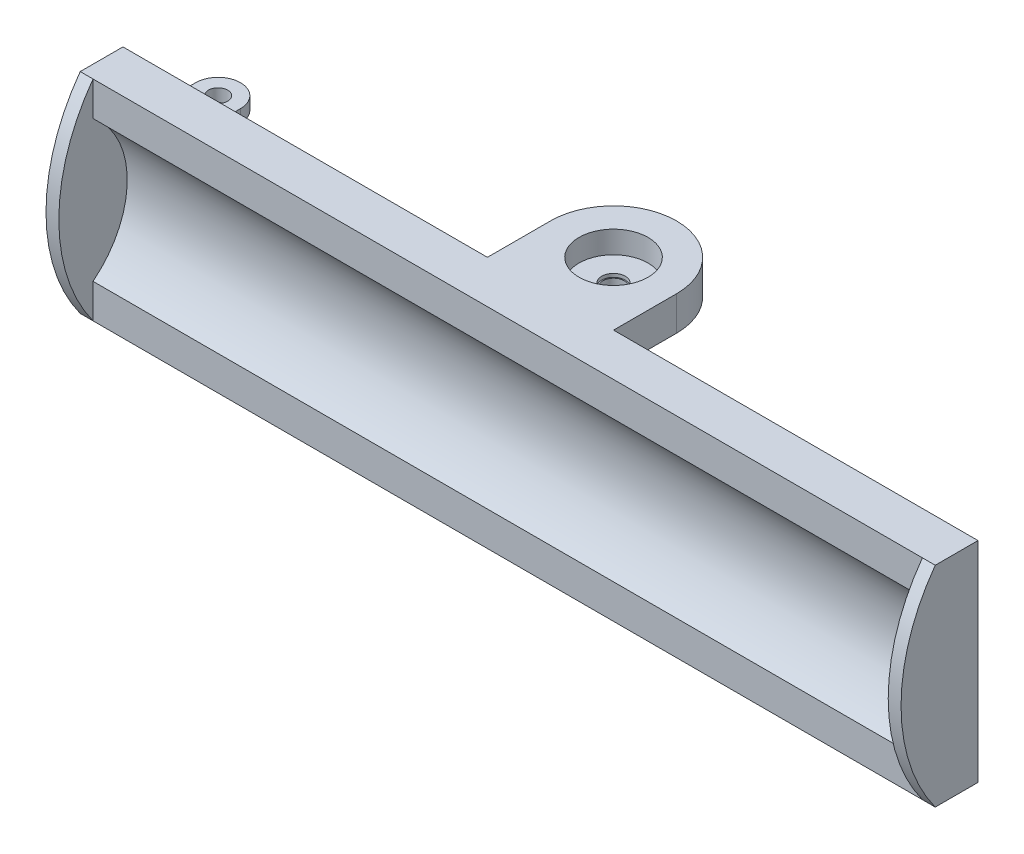
from build123d import *

# Parameters (mm, degrees)
BOSS_EXTRUDE1_DEPTH = 100
SKETCH3_R           = 2.75
BOSS_EXTRUDE2_DEPTH = 8
SKETCH4_R           = 8.075
SKETCH4_R_2         = 2.75
CUT_EXTRUDE1_DEPTH  = 5.2
BOSS_EXTRUDE4_START = -2
SKETCH5_R           = 2.75
SKETCH5_R_2         = 2.5
BOSS_EXTRUDE4_DEPTH = 2
BOSS_EXTRUDE5_START = 8
BOSS_EXTRUDE5_DEPTH = 3
BOSS_EXTRUDE6_DEPTH = 3


with BuildPart() as part:
    # Sketch1 → Boss-Extrude1 (new, symmetric)
    with BuildSketch(Plane.YZ):
        with BuildLine():
            Line((-24.5, 5), (-24.5, -5))
            Line((-24.5, -5), (24.5, -5))
            Line((24.5, -5), (24.5, 5))
            Line((24.5, 5), (16.492422502, 5))
            ThreePointArc((16.492422502, 5), (0, -3), (-16.492422502, 5))
            Line((-16.492422502, 5), (-24.5, 5))
        make_face()
    extrude(amount=BOSS_EXTRUDE1_DEPTH, both=True)

    # Sketch3 → Boss-Extrude2 (add)
    with BuildSketch(Plane.XZ.offset(24.5)):
        with BuildLine():
            ThreePointArc((-14.75, -19.75), (0, -34.5), (14.75, -19.75))
            Line((14.75, -19.75), (14.75, -5))
            Line((14.75, -5), (-14.75, -5))
            Line((-14.75, -5), (-14.75, -19.75))
        make_face()
        with Locations((0, -19.75)):
            Circle(SKETCH3_R, mode=Mode.SUBTRACT)
    boss_extrude2 = extrude(amount=-BOSS_EXTRUDE2_DEPTH)

    # Sketch4 → Cut-Extrude1 (cut)
    with BuildSketch(Plane(origin=(0, -24.5, 0), x_dir=(-1, 0, 0), z_dir=(0, -1, 0))):
        with Locations((0, 19.75)):
            Circle(SKETCH4_R)
        with Locations((0, 19.75)):
            Circle(SKETCH4_R_2, mode=Mode.SUBTRACT)
    cut_extrude1 = extrude(amount=-CUT_EXTRUDE1_DEPTH, mode=Mode.SUBTRACT)

    # Sketch5 → Boss-Extrude4 (add)
    with BuildSketch(Plane(origin=(0, -16.5, 0), x_dir=(-1, 0, 0), z_dir=(0, 1, 0)).offset(BOSS_EXTRUDE4_START)):
        with Locations((0, -19.75)):
            Circle(SKETCH5_R)
        with Locations((0, -19.75)):
            Circle(SKETCH5_R_2, mode=Mode.SUBTRACT)
    boss_extrude4 = extrude(amount=BOSS_EXTRUDE4_DEPTH)

    # Mirror1: Boss-Extrude2, Cut-Extrude1, Boss-Extrude4 across plane
    add(boss_extrude2.mirror(Plane(origin=(0, 0, 0), x_dir=(0, 0, 1), z_dir=(0, -1, 0))))
    add(cut_extrude1.mirror(Plane(origin=(0, 0, 0), x_dir=(0, 0, 1), z_dir=(0, -1, 0))), mode=Mode.SUBTRACT)
    add(boss_extrude4.mirror(Plane(origin=(0, 0, 0), x_dir=(0, 0, 1), z_dir=(0, -1, 0))))

    # Sketch6 → Boss-Extrude5 (add)
    with BuildSketch(Plane(origin=(0, 0, 0), x_dir=(-1, 0, 0), z_dir=(0, -1, 0)).offset(BOSS_EXTRUDE5_START)):
        with BuildLine():
            ThreePointArc((97.75, 19.75), (92.5, 25), (87.25, 19.75))
            Line((87.25, 19.75), (87.25, 5))
            Line((87.25, 5), (97.75, 5))
            Line((97.75, 5), (97.75, 19.75))
        make_face()
        with BuildLine():
            ThreePointArc((94.75, 19.75), (92.5, 17.5), (90.25, 19.75))
            ThreePointArc((90.25, 19.75), (92.5, 22), (94.75, 19.75))
        make_face(mode=Mode.SUBTRACT)
    boss_extrude5 = extrude(amount=BOSS_EXTRUDE5_DEPTH)

    # Mirror2: Boss-Extrude5 across plane
    add(boss_extrude5.mirror(Plane(origin=(0, 0, 0), x_dir=(0, 0, 1), z_dir=(0, -1, 0))))

    # Sketch7 → Boss-Extrude6 (add)
    with BuildSketch(Plane(origin=(-100, 0, 0), x_dir=(0, -1, 0), z_dir=(-1, 0, 0))):
        with BuildLine():
            ThreePointArc((24.5, 5), (0, 13), (-24.5, 5))
            Line((-24.5, 5), (-24.5, -5))
            Line((-24.5, -5), (24.5, -5))
            Line((24.5, -5), (24.5, 5))
        make_face()
    boss_extrude6 = extrude(amount=-BOSS_EXTRUDE6_DEPTH)

    # Mirror3: Boss-Extrude6 across plane
    add(boss_extrude6.mirror(Plane(origin=(0, 0, 0), x_dir=(0, 0, 1), z_dir=(1, 0, 0))))


solid = part.part
